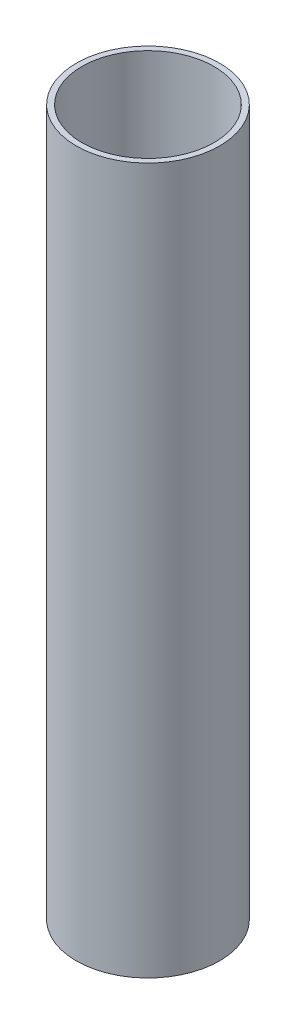
from build123d import *

# Parameters (mm, degrees)
SKETCH1_R           = 25.4
SKETCH1_R_2         = 23.4
BOSS_EXTRUDE1_DEPTH = 125


with BuildPart() as part:
    # Sketch1 → Boss-Extrude1 (new, symmetric)
    with BuildSketch(Plane(origin=(0, 0, 0), x_dir=(1, 0, 0), z_dir=(0, 1, 0))):
        Circle(SKETCH1_R)
        Circle(SKETCH1_R_2, mode=Mode.SUBTRACT)
    extrude(amount=BOSS_EXTRUDE1_DEPTH, both=True)


solid = part.part
